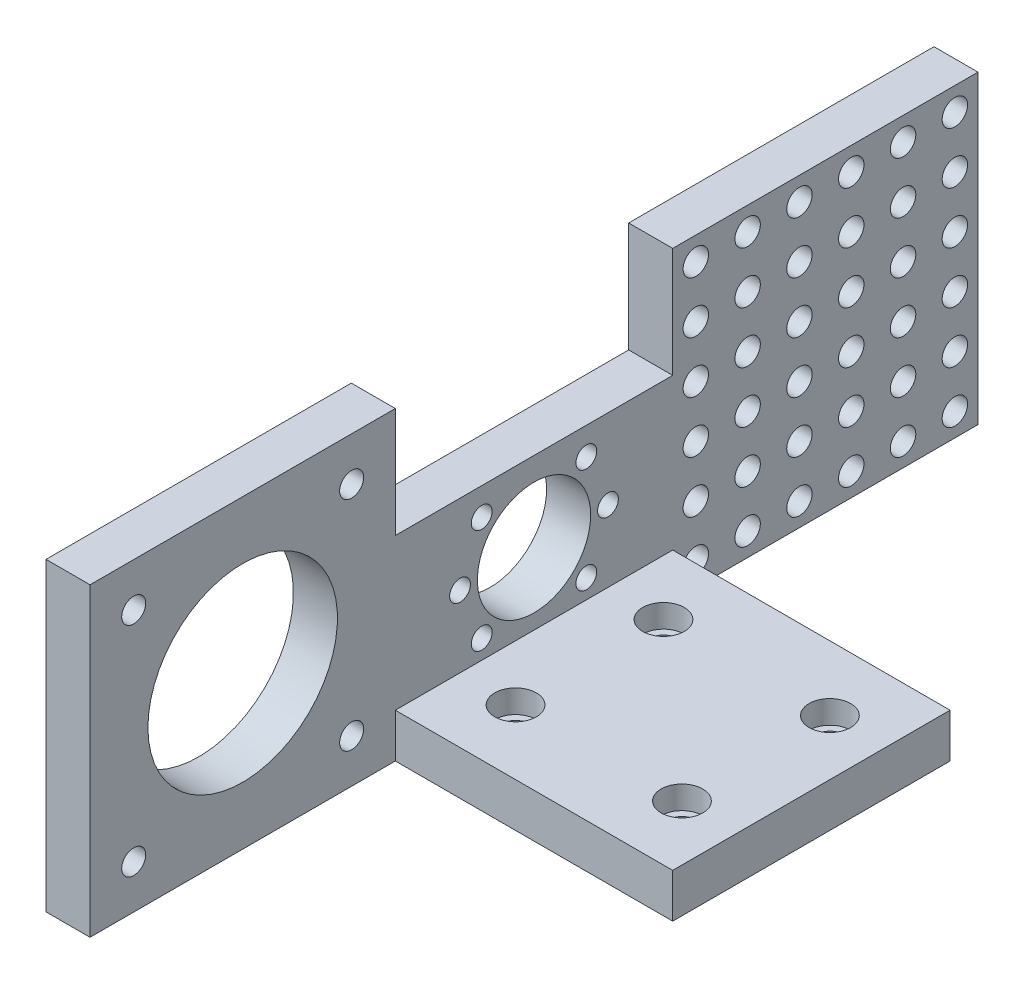
from build123d import *

# Parameters (mm, degrees)
SKETCH1_W           = 60
SKETCH1_H           = 60
SKETCH1_R           = 2.95
BOSS_EXTRUDE1_DEPTH = 9.525
SKETCH2_R           = 4.5
CUT_EXTRUDE1_DEPTH  = 5
SKETCH3_W           = 60
SKETCH3_H           = 42.25
SKETCH3_R           = 12.25
SKETCH3_R_2         = 2.25
BOSS_EXTRUDE2_DEPTH = 9.525
SKETCH4_W           = 66.04
SKETCH4_H           = 66.04
SKETCH4_R           = 2.6
SKETCH4_R_2         = 20.5
SKETCH4_R_3         = 2.75
BOSS_EXTRUDE3_DEPTH = 9.525


with BuildPart() as part:
    # Sketch1 → Boss-Extrude1 (new body)
    with BuildSketch(Plane(origin=(0, 0, 0), x_dir=(1, 0, 0), z_dir=(0, 1, 0))):
        with Locations((30, 30)):
            Rectangle(SKETCH1_W, SKETCH1_H)
        with Locations((12, 14)):
            Circle(SKETCH1_R, mode=Mode.SUBTRACT)
        with Locations((12, 46)):
            Circle(SKETCH1_R, mode=Mode.SUBTRACT)
        with Locations((48, 46)):
            Circle(SKETCH1_R, mode=Mode.SUBTRACT)
        with Locations((48, 14)):
            Circle(SKETCH1_R, mode=Mode.SUBTRACT)
    extrude(amount=BOSS_EXTRUDE1_DEPTH)

    # Sketch2 → Cut-Extrude1 (cut)
    with BuildSketch(Plane(origin=(0, 9.525, 0), x_dir=(1, 0, 0), z_dir=(0, 1, 0))):
        with Locations((12, 14)):
            Circle(SKETCH2_R)
        with Locations((12, 46)):
            Circle(SKETCH2_R)
        with Locations((48, 46)):
            Circle(SKETCH2_R)
        with Locations((48, 14)):
            Circle(SKETCH2_R)
    extrude(amount=-CUT_EXTRUDE1_DEPTH, mode=Mode.SUBTRACT)

    # Sketch3 → Boss-Extrude2 (add)
    with BuildSketch(Plane.ZY):
        with Locations((-30, 21.125)):
            Rectangle(SKETCH3_W, SKETCH3_H)
        with Locations((-30, 25)):
            Circle(SKETCH3_R, mode=Mode.SUBTRACT)
        with Locations((-18.686291501, 36.313708499)):
            Circle(SKETCH3_R_2, mode=Mode.SUBTRACT)
        with Locations((-14, 25)):
            Circle(SKETCH3_R_2, mode=Mode.SUBTRACT)
        with Locations((-18.686291501, 13.686291501)):
            Circle(SKETCH3_R_2, mode=Mode.SUBTRACT)
        with Locations((-41.313708499, 13.686291501)):
            Circle(SKETCH3_R_2, mode=Mode.SUBTRACT)
        with Locations((-46, 25)):
            Circle(SKETCH3_R_2, mode=Mode.SUBTRACT)
        with Locations((-41.313708499, 36.313708499)):
            Circle(SKETCH3_R_2, mode=Mode.SUBTRACT)
    extrude(amount=BOSS_EXTRUDE2_DEPTH)

    # Sketch4 → Boss-Extrude3 (add)
    # profile 1 of 2: a face of its own
    with BuildSketch(Plane.ZY.offset(9.525)):
        with Locations((33.02, 33.02)):
            Rectangle(SKETCH4_W, SKETCH4_H)
        with Locations((56.59, 56.59)):
            Circle(SKETCH4_R, mode=Mode.SUBTRACT)
        with Locations((9.45, 56.59)):
            Circle(SKETCH4_R, mode=Mode.SUBTRACT)
        with Locations((9.45, 9.45)):
            Circle(SKETCH4_R, mode=Mode.SUBTRACT)
        with Locations((56.59, 9.45)):
            Circle(SKETCH4_R, mode=Mode.SUBTRACT)
        with Locations((33.02, 33.02)):
            Circle(SKETCH4_R_2, mode=Mode.SUBTRACT)
    # profile 2 of 2: a face of its own
    with BuildSketch(Plane.ZY.offset(9.525)):
        with Locations((-93.02, 33.02)):
            Rectangle(SKETCH4_W, SKETCH4_H)
        with Locations((-121.04, 61.04)):
            Circle(SKETCH4_R_3, mode=Mode.SUBTRACT)
        with Locations((-109.832, 61.04)):
            Circle(SKETCH4_R_3, mode=Mode.SUBTRACT)
        with Locations((-98.624, 61.04)):
            Circle(SKETCH4_R_3, mode=Mode.SUBTRACT)
        with Locations((-87.416, 61.04)):
            Circle(SKETCH4_R_3, mode=Mode.SUBTRACT)
        with Locations((-76.208, 61.04)):
            Circle(SKETCH4_R_3, mode=Mode.SUBTRACT)
        with Locations((-65, 61.04)):
            Circle(SKETCH4_R_3, mode=Mode.SUBTRACT)
        with Locations((-109.832, 49.832)):
            Circle(SKETCH4_R_3, mode=Mode.SUBTRACT)
        with Locations((-98.624, 49.832)):
            Circle(SKETCH4_R_3, mode=Mode.SUBTRACT)
        with Locations((-87.416, 49.832)):
            Circle(SKETCH4_R_3, mode=Mode.SUBTRACT)
        with Locations((-76.208, 49.832)):
            Circle(SKETCH4_R_3, mode=Mode.SUBTRACT)
        with Locations((-65, 49.832)):
            Circle(SKETCH4_R_3, mode=Mode.SUBTRACT)
        with Locations((-109.832, 38.624)):
            Circle(SKETCH4_R_3, mode=Mode.SUBTRACT)
        with Locations((-98.624, 38.624)):
            Circle(SKETCH4_R_3, mode=Mode.SUBTRACT)
        with Locations((-87.416, 38.624)):
            Circle(SKETCH4_R_3, mode=Mode.SUBTRACT)
        with Locations((-76.208, 38.624)):
            Circle(SKETCH4_R_3, mode=Mode.SUBTRACT)
        with Locations((-65, 38.624)):
            Circle(SKETCH4_R_3, mode=Mode.SUBTRACT)
        with Locations((-109.832, 27.416)):
            Circle(SKETCH4_R_3, mode=Mode.SUBTRACT)
        with Locations((-98.624, 27.416)):
            Circle(SKETCH4_R_3, mode=Mode.SUBTRACT)
        with Locations((-87.416, 27.416)):
            Circle(SKETCH4_R_3, mode=Mode.SUBTRACT)
        with Locations((-76.208, 27.416)):
            Circle(SKETCH4_R_3, mode=Mode.SUBTRACT)
        with Locations((-65, 27.416)):
            Circle(SKETCH4_R_3, mode=Mode.SUBTRACT)
        with Locations((-109.832, 16.208)):
            Circle(SKETCH4_R_3, mode=Mode.SUBTRACT)
        with Locations((-98.624, 16.208)):
            Circle(SKETCH4_R_3, mode=Mode.SUBTRACT)
        with Locations((-87.416, 16.208)):
            Circle(SKETCH4_R_3, mode=Mode.SUBTRACT)
        with Locations((-76.208, 16.208)):
            Circle(SKETCH4_R_3, mode=Mode.SUBTRACT)
        with Locations((-65, 16.208)):
            Circle(SKETCH4_R_3, mode=Mode.SUBTRACT)
        with Locations((-109.832, 5)):
            Circle(SKETCH4_R_3, mode=Mode.SUBTRACT)
        with Locations((-98.624, 5)):
            Circle(SKETCH4_R_3, mode=Mode.SUBTRACT)
        with Locations((-87.416, 5)):
            Circle(SKETCH4_R_3, mode=Mode.SUBTRACT)
        with Locations((-76.208, 5)):
            Circle(SKETCH4_R_3, mode=Mode.SUBTRACT)
        with Locations((-65, 5)):
            Circle(SKETCH4_R_3, mode=Mode.SUBTRACT)
        with Locations((-121.04, 49.832)):
            Circle(SKETCH4_R_3, mode=Mode.SUBTRACT)
        with Locations((-121.04, 38.624)):
            Circle(SKETCH4_R_3, mode=Mode.SUBTRACT)
        with Locations((-121.04, 27.416)):
            Circle(SKETCH4_R_3, mode=Mode.SUBTRACT)
        with Locations((-121.04, 16.208)):
            Circle(SKETCH4_R_3, mode=Mode.SUBTRACT)
        with Locations((-121.04, 5)):
            Circle(SKETCH4_R_3, mode=Mode.SUBTRACT)
    extrude(amount=-BOSS_EXTRUDE3_DEPTH)


solid = part.part
